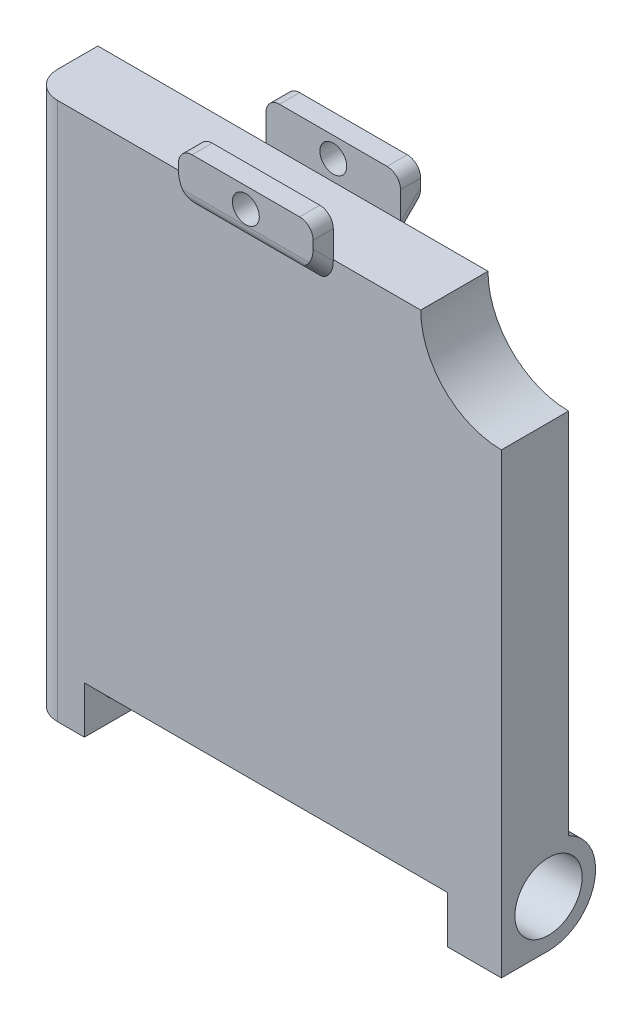
from build123d import *

# Parameters (mm, degrees)
SKETCH1_W           = 35
SKETCH1_H           = 36.5
BOSS_EXTRUDE1_DEPTH = 2.5
SKETCH3_R           = 3.5
CUT_EXTRUDE1_DEPTH  = 35
SKETCH4_R           = 2.5
BOSS_EXTRUDE3_DEPTH = 4
SKETCH5_W           = 1.5
SKETCH5_H           = 3
BOSS_EXTRUDE4_DEPTH = 5
CUT_EXTRUDE2_REACH  = 55.456
SKETCH6_R           = 1
FILLET1_R           = 1
FILLET2_R           = 1
SKETCH7_R           = 6
CUT_EXTRUDE3_DEPTH  = 5
FILLET3_R           = 2


with BuildPart() as part:
    # Sketch1 → Boss-Extrude1 (new, symmetric)
    with BuildSketch(Plane.XY):
        with Locations((17.5, 18.25)):
            Rectangle(SKETCH1_W, SKETCH1_H)
    extrude(amount=BOSS_EXTRUDE1_DEPTH, both=True)

    # Sketch3 → Cut-Extrude1 (cut)
    with BuildSketch(Plane(origin=(35, 0, 0), x_dir=(0, 0, -1), z_dir=(1, 0, 0))):
        with Locations((1, 0)):
            Circle(SKETCH3_R)
    extrude(amount=-CUT_EXTRUDE1_DEPTH, mode=Mode.SUBTRACT)

    # Sketch4 → Boss-Extrude3 (add)
    # profile 1 of 2: a face of its own
    with BuildSketch(Plane(origin=(35, 0, 0), x_dir=(0, 0, -1), z_dir=(1, 0, 0))):
        with BuildLine():
            ThreePointArc((2.5, 3.16227766), (-0.870828693, 2.958039892), (-2.5, 0))
            ThreePointArc((-2.5, 0), (-1.474873734, -2.474873734), (1, -3.5))
            ThreePointArc((1, -3.5), (3.474873734, -2.474873734), (4.5, 0))
            ThreePointArc((4.5, 0), (3.958039892, 1.870828693), (2.5, 3.16227766))
        make_face()
        with Locations((1, 0)):
            Circle(SKETCH4_R, mode=Mode.SUBTRACT)
    # profile 2 of 2: a face of its own
    with BuildSketch(Plane(origin=(35, 0, 0), x_dir=(0, 0, -1), z_dir=(1, 0, 0))):
        with BuildLine():
            ThreePointArc((1, -3.5), (-1.474873734, -2.474873734), (-2.5, 0))
            Line((-2.5, 0), (-2.5, -3.5))
            Line((-2.5, -3.5), (1, -3.5))
        make_face()
    boss_extrude3 = extrude(amount=-BOSS_EXTRUDE3_DEPTH)

    # Mirror2: Boss-Extrude3 across plane
    add(boss_extrude3.mirror(Plane(origin=(17.5, 0, 0), x_dir=(0, 0, 1), z_dir=(1, 0, 0))))

    # Sketch5 → Boss-Extrude4 (add, symmetric)
    with BuildSketch(Plane(origin=(17.5, 0, 0), x_dir=(0, 0, -1), z_dir=(1, 0, 0))):
        with Locations((-3.25, 38)):
            Rectangle(SKETCH5_W, SKETCH5_H)
        Polygon((-4, 36.5), (-2.5, 35), (-2.5, 36.5), align=None)
        Polygon((2.5, 35), (2.5, 36.5), (4, 36.5), align=None)
        with Locations((3.25, 38)):
            Rectangle(SKETCH5_W, SKETCH5_H)
    extrude(amount=BOSS_EXTRUDE4_DEPTH, both=True)

    # Cut-Extrude2: up to this face of the body (flat: up to its plane)
    cut_extrude2_end = Plane(part.part.faces().sort_by_distance((17.5, 38, -4))[0])
    # Sketch6 → Cut-Extrude2 (cut, up to the picked face)
    with BuildSketch(Plane.XY.offset(4), mode=Mode.PRIVATE) as cut_extrude2_sk1:
        with Locations(Location((17.5, 38, 0), (0, 0, 270))):
            Circle(SKETCH6_R)
    cut_extrude2_tool1 = split(extrude(cut_extrude2_sk1.sketch, amount=-CUT_EXTRUDE2_REACH, mode=Mode.PRIVATE), bisect_by=cut_extrude2_end, keep=Keep.BOTH, mode=Mode.PRIVATE)
    add(cut_extrude2_tool1.solids().sort_by(Axis((17.5, 38, 4), (0, 0, -1)))[0], mode=Mode.SUBTRACT)

    # Fillet1
    fillet1_edges = [part.edges().sort_by_distance(p)[0] for p in [
        (12.5, 35.75, 3.25),
        (17.5, 36.5, 4),
        (22.5, 35.75, 3.25),
        (22.5, 35.75, -3.25),
        (17.5, 36.5, -4),
        (12.5, 35.75, -3.25),
    ]]
    fillet(fillet1_edges, radius=FILLET1_R)

    # Fillet2
    fillet2_edges = [part.edges().sort_by_distance(p)[0] for p in [
        (22.5, 39.5, 3.25),
        (12.5, 39.5, 3.25),
        (22.5, 39.5, -3.25),
        (12.5, 39.5, -3.25),
    ]]
    fillet(fillet2_edges, radius=FILLET2_R)

    # Sketch7 → Cut-Extrude3 (cut)
    with BuildSketch(Plane.XY.offset(2.5)):
        with Locations((35, 36.5)):
            Circle(SKETCH7_R)
    extrude(amount=-CUT_EXTRUDE3_DEPTH, mode=Mode.SUBTRACT)

    # Fillet3
    # the kernel refuses this fillet: 2 mm, written as the material it takes off along each edge
    with BuildSketch(Plane(origin=(0, -8.5, 2.5), x_dir=(1, 0, 0), z_dir=(0, 1, 0))) as fillet3_piece_1:
        with BuildLine():
            CenterArc((FILLET3_R, FILLET3_R), FILLET3_R, 180, 90)
            Line((0, FILLET3_R), (0, 0))
            Line((0, 0), (FILLET3_R, 0))
        make_face()
    extrude(amount=50, mode=Mode.SUBTRACT)


solid = part.part
